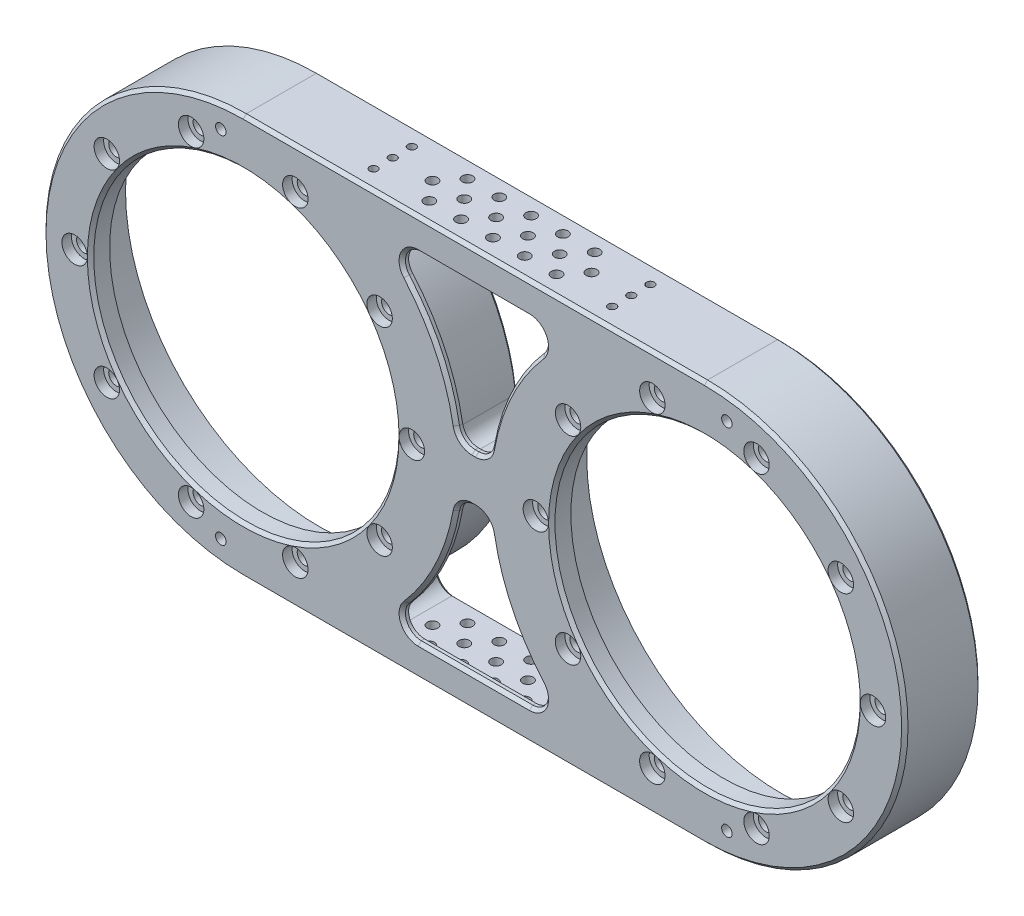
from build123d import *

# Parameters (mm, degrees)
SKETCH_1_R                   = 60
EXTRUDE_1_DEPTH              = 3
EXTRUDE_START                = 6
SKETCH_2_R                   = 48
EXTRUDE_2_DEPTH              = 6
SKETCH_3_R                   = 61
EXTRUDE_3_DEPTH              = 15
CUT_EXTRUDE_START            = -22
CUT_EXTRUDE_1_DEPTH          = 22
CUT_EXTRUDE_2_DEPTH          = 20
FILLET_2_R                   = 5
CHAMFER_2_SIZE               = 1
PATTERN_CIRCULAR_1_COUNT     = 10
PATTERN_CIRCULAR_2_COUNT     = 10
HOLE_WIZARD_M4_1_AT_2_COUNT  = 2
HOLE_WIZARD_M4_1_AT_2_PITCH  = 12
HOLE_WIZARD_M4_1_AT_3_COUNT  = 2
HOLE_WIZARD_M4_1_AT_3_PITCH  = 7.810249676
HOLE_WIZARD_M4_1_AT_4_COUNT  = 2
HOLE_WIZARD_M4_1_AT_4_PITCH  = 7.810249676
HOLE_WIZARD_M4_1_AT_5_COUNT  = 2
HOLE_WIZARD_M4_1_AT_5_PITCH  = 10
HOLE_WIZARD_M4_1_AT_6_COUNT  = 2
HOLE_WIZARD_M4_1_AT_6_PITCH  = 16.155494421
HOLE_WIZARD_M4_1_AT_7_COUNT  = 2
HOLE_WIZARD_M4_1_AT_7_PITCH  = 15.620499352
HOLE_WIZARD_M4_1_AT_8_COUNT  = 2
HOLE_WIZARD_M4_1_AT_8_PITCH  = 23.323807579
HOLE_WIZARD_M4_1_AT_9_COUNT  = 2
HOLE_WIZARD_M4_1_AT_9_PITCH  = 25.709920264
HOLE_WIZARD_M4_1_AT_10_COUNT = 2
HOLE_WIZARD_M4_1_AT_10_PITCH = 20
HOLE_WIZARD_M4_1_AT_11_COUNT = 2
HOLE_WIZARD_M4_1_AT_11_PITCH = 10
HOLE_WIZARD_M4_1_AT_12_COUNT = 2
HOLE_WIZARD_M4_1_AT_12_PITCH = 16.155494421
HOLE_WIZARD_M4_1_AT_13_COUNT = 2
HOLE_WIZARD_M4_1_AT_13_PITCH = 15.620499352
HOLE_WIZARD_M4_1_AT_14_COUNT = 2
HOLE_WIZARD_M4_1_AT_14_PITCH = 23.323807579
HOLE_WIZARD_M4_1_AT_15_COUNT = 2
HOLE_WIZARD_M4_1_AT_15_PITCH = 25.709920264
HOLE_WIZARD_M4_1_AT_16_COUNT = 2
HOLE_WIZARD_M4_1_AT_16_PITCH = 20
HOLE_WIZARD_M3_1_AT_2_COUNT  = 2
HOLE_WIZARD_M3_1_AT_2_PITCH  = 6
HOLE_WIZARD_M3_1_AT_3_COUNT  = 2
HOLE_WIZARD_M3_1_AT_3_PITCH  = 12
HOLE_WIZARD_M3_1_AT_4_COUNT  = 2
HOLE_WIZARD_M3_1_AT_4_PITCH  = 75.953933407
HOLE_WIZARD_M3_1_AT_5_COUNT  = 2
HOLE_WIZARD_M3_1_AT_5_PITCH  = 75.239617224
HOLE_WIZARD_M3_1_AT_6_COUNT  = 2
HOLE_WIZARD_M3_1_AT_6_PITCH  = 75
HOLE_WIZARD_M4_2_D           = 3.3
HOLE_WIZARD_M4_2_DEPTH       = 22
HOLE_WIZARD_M4_2_TIP         = 0.991420021


with BuildPart() as part:
    # 草图1 → 凸台-拉伸1 (new body)
    with BuildSketch(Plane.XY):
        with BuildLine():
            Line((0, 63), (145, 63))
            ThreePointArc((145, 63), (208, 0), (145, -63))
            Line((145, -63), (0, -63))
            ThreePointArc((0, -63), (-63, 0), (0, 63))
        make_face()
        Circle(SKETCH_1_R, mode=Mode.SUBTRACT)
        with Locations((145, 0)):
            Circle(SKETCH_1_R, mode=Mode.SUBTRACT)
    extrude(amount=-EXTRUDE_1_DEPTH)

    # 草图2 → 凸台-拉伸2 (add)
    with BuildSketch(Plane.XY.offset(EXTRUDE_START)):
        with BuildLine():
            Line((0, -63), (145, -63))
            ThreePointArc((145, -63), (208, 0), (145, 63))
            Line((145, 63), (0, 63))
            ThreePointArc((0, 63), (-63, 0), (0, -63))
        make_face()
        Circle(SKETCH_2_R, mode=Mode.SUBTRACT)
        with Locations((145, 0)):
            Circle(SKETCH_2_R, mode=Mode.SUBTRACT)
    extrude(amount=-EXTRUDE_2_DEPTH)

    # 草图3 → 凸台-拉伸3 (add)
    with BuildSketch(Plane(origin=(0, 0, -3), x_dir=(-1, 0, 0), z_dir=(0, 0, -1))):
        with BuildLine():
            Line((0, 63), (-145, 63))
            ThreePointArc((-145, 63), (-208, 0), (-145, -63))
            Line((-145, -63), (0, -63))
            ThreePointArc((0, -63), (63, 0), (0, 63))
        make_face()
        with Locations((-145, 0)):
            Circle(SKETCH_3_R, mode=Mode.SUBTRACT)
        Circle(SKETCH_3_R, mode=Mode.SUBTRACT)
    extrude(amount=EXTRUDE_3_DEPTH)

    # 草图4 → 切除-拉伸1 (cut)
    with BuildSketch(Plane(origin=(0, 0, -18), x_dir=(-1, 0, 0), z_dir=(0, 0, -1)).offset(CUT_EXTRUDE_START)):
        with BuildLine():
            ThreePointArc((-120.403252248, 58), (-93.171559203, 35.816375089), (-82.049622718, 2.5))
            Line((-82.049622718, 2.5), (-62.950377282, 2.5))
            ThreePointArc((-62.950377282, 2.5), (-51.828440797, 35.816375089), (-24.596747752, 58))
            Line((-24.596747752, 58), (-120.403252248, 58))
        make_face()
        with BuildLine():
            Line((-62.950377282, -2.5), (-82.049622718, -2.5))
            ThreePointArc((-82.049622718, -2.5), (-93.171559203, -35.816375089), (-120.403252248, -58))
            Line((-120.403252248, -58), (-24.596747752, -58))
            ThreePointArc((-24.596747752, -58), (-51.828440797, -35.816375089), (-62.950377282, -2.5))
        make_face()
    extrude(amount=CUT_EXTRUDE_1_DEPTH, mode=Mode.SUBTRACT)

    # 草图7 → 切除-拉伸2 (cut)
    with BuildSketch(Plane(origin=(0, 0, 4), x_dir=(-1, 0, 0), z_dir=(0, 0, -1))):
        with BuildLine():
            Line((-42.602816808, 53), (-102.397183192, 53))
            ThreePointArc((-102.397183192, 53), (-85.393721068, 32.72753446), (-77.414868499, 7.5))
            Line((-77.414868499, 7.5), (-67.585131501, 7.5))
            ThreePointArc((-67.585131501, 7.5), (-59.606278932, 32.72753446), (-42.602816808, 53))
        make_face()
        with BuildLine():
            Line((-67.585131501, -7.5), (-77.414868499, -7.5))
            ThreePointArc((-77.414868499, -7.5), (-85.393721068, -32.72753446), (-102.397183192, -53))
            Line((-102.397183192, -53), (-42.602816808, -53))
            ThreePointArc((-42.602816808, -53), (-59.606278932, -32.72753446), (-67.585131501, -7.5))
        make_face()
    extrude(amount=-CUT_EXTRUDE_2_DEPTH, mode=Mode.SUBTRACT)

    # 圆角2
    fillet_2_edges = [part.edges().sort_by_distance(p)[0] for p in [
        (42.602816808, 53, 5),
        (67.585131501, 7.5, 5),
        (77.414868499, 7.5, 5),
        (102.397183192, 53, 5),
        (24.596747752, 58, -7),
        (62.950377282, 2.5, -7),
        (82.049622718, 2.5, -7),
        (120.403252248, 58, -7),
        (62.950377282, -2.5, -7),
        (24.596747752, -58, -7),
        (120.403252248, -58, -7),
        (82.049622718, -2.5, -7),
        (67.585131501, -7.5, 5),
        (42.602816808, -53, 5),
        (102.397183192, -53, 5),
        (77.414868499, -7.5, 5),
    ]]
    fillet(fillet_2_edges, radius=FILLET_2_R)

    # 倒角2
    chamfer_2_edges = [part.edges().sort_by_distance(p)[0] for p in [
        (-60, 0, -3),
        (61.383052994, 29.259542121, 6),
        (72.5, 7.5, 6),
        (83.616947006, 29.259542121, 6),
        (61.383052994, -29.259542121, 6),
        (72.5, -53, 6),
        (83.616947006, -29.259542121, 6),
        (72.5, -7.5, 6),
        (72.5, 53, 6),
        (72.5, 2.5, -18),
        (89.776535695, 30.321098103, -18),
        (55.223464305, 30.321098103, -18),
        (72.5, 58, -18),
        (89.776535695, -30.321098103, -18),
        (72.5, -2.5, -18),
        (85, 0, -3),
        (72.5, -58, -18),
        (55.223464305, -30.321098103, -18),
        (68.703201021, 8.673721004, 6),
        (76.296798979, 8.673721004, 6),
        (50.448167613, -50.069014722, 6),
        (94.551832387, -50.069014722, 6),
        (76.296798979, -8.673721004, 6),
        (68.703201021, -8.673721004, 6),
        (50.448167613, 50.069014722, 6),
        (94.551832387, 50.069014722, 6),
        (80.749733343, 3.774590429, -18),
        (64.250266657, 3.774590429, -18),
        (37.886605717, 54.66052791, -18),
        (80.749733343, -3.774590429, -18),
        (107.113394283, -54.66052791, -18),
        (37.886605717, -54.66052791, -18),
        (64.250266657, -3.774590429, -18),
        (107.113394283, 54.66052791, -18),
        (-63, 0, 6),
        (72.5, -63, 6),
        (208, 0, 6),
        (72.5, 63, 6),
        (-48, 0, 6),
        (97, 0, 6),
        (-63, 0, -18),
        (72.5, 63, -18),
        (208, 0, -18),
        (72.5, -63, -18),
    ]]
    chamfer(chamfer_2_edges, length=CHAMFER_2_SIZE - 0.0001)  # a hair under: the kernel refuses the full size

    # 草图10 → 打孔尺寸(%根据)内六角圆柱头螺钉的类型1 (revolve, cut)
    with BuildSketch(Plane(origin=(198, 0, 6), x_dir=(0, -1, 0), z_dir=(1, 0, 0))):
        Polygon((0, 0), (0, 11.542065486), (2.4, 10.1), (2.4, 3), (4, 3), (4, 0), align=None)
    hole_wizard_1 = revolve(axis=Axis((198, 0, 12.35), (0, 0, -1)), mode=Mode.SUBTRACT)

    # 草图12 → 打孔尺寸(%根据)内六角圆柱头螺钉的类型2 (revolve, cut)
    with BuildSketch(Plane(origin=(53, 0, 6), x_dir=(0, -1, 0), z_dir=(1, 0, 0))):
        Polygon((0, 0), (0, 11.542065486), (2.4, 10.1), (2.4, 3), (4, 3), (4, 0), align=None)
    hole_wizard_2 = revolve(axis=Axis((53, 0, 12.35), (0, 0, -1)), mode=Mode.SUBTRACT)

    # 阵列(圆周)1: 打孔尺寸(%根据)内六角圆柱头螺钉的类型1 ×10 about axis
    pattern_circular_1_axis = Axis((145, 0, 0), (0, 0, 1))
    for i in range(1, PATTERN_CIRCULAR_1_COUNT):
        add(hole_wizard_1.rotate(pattern_circular_1_axis, i * 360 / PATTERN_CIRCULAR_1_COUNT), mode=Mode.SUBTRACT)

    # 阵列(圆周)2: 打孔尺寸(%根据)内六角圆柱头螺钉的类型2 ×10 about axis
    pattern_circular_2_axis = Axis((0, 0, 0), (0, 0, 1))
    for i in range(1, PATTERN_CIRCULAR_2_COUNT):
        add(hole_wizard_2.rotate(pattern_circular_2_axis, i * 360 / PATTERN_CIRCULAR_2_COUNT), mode=Mode.SUBTRACT)

    # 草图18 → M4 螺纹孔1 (revolve, cut)
    with BuildSketch(Plane(origin=(72.5, 63, -12), x_dir=(0, 0, 1), z_dir=(1, 0, 0))):
        Polygon((0, 0), (0, 11.091420021), (1.65, 10.1), (1.65, 0), align=None)
    hole_wizard_m4_1 = revolve(axis=Axis((72.5, 69.35, -12), (0, -1, 0)), mode=Mode.SUBTRACT)

    # M4 螺纹孔1 at 2: M4 螺纹孔1 ×2
    with Locations(*[(0, 0, i * HOLE_WIZARD_M4_1_AT_2_PITCH) for i in range(1, HOLE_WIZARD_M4_1_AT_2_COUNT)]):
        add(hole_wizard_m4_1, mode=Mode.SUBTRACT)

    # M4 螺纹孔1 at 3: M4 螺纹孔1 ×2
    with Locations(*[Vector(0.6401843996644799, 0, 0.7682212795973757) * (i * HOLE_WIZARD_M4_1_AT_3_PITCH) for i in range(1, HOLE_WIZARD_M4_1_AT_3_COUNT)]):
        add(hole_wizard_m4_1, mode=Mode.SUBTRACT)

    # M4 螺纹孔1 at 4: M4 螺纹孔1 ×2
    with Locations(*[Vector(-0.6401843996644809, 0, 0.768221279597375) * (i * HOLE_WIZARD_M4_1_AT_4_PITCH) for i in range(1, HOLE_WIZARD_M4_1_AT_4_COUNT)]):
        add(hole_wizard_m4_1, mode=Mode.SUBTRACT)

    # M4 螺纹孔1 at 5: M4 螺纹孔1 ×2
    with Locations(*[(-i * HOLE_WIZARD_M4_1_AT_5_PITCH, 0, 0) for i in range(1, HOLE_WIZARD_M4_1_AT_5_COUNT)]):
        add(hole_wizard_m4_1, mode=Mode.SUBTRACT)

    # M4 螺纹孔1 at 6: M4 螺纹孔1 ×2
    with Locations(*[Vector(-0.9284766908852594, 0, 0.3713906763541038) * (i * HOLE_WIZARD_M4_1_AT_6_PITCH) for i in range(1, HOLE_WIZARD_M4_1_AT_6_COUNT)]):
        add(hole_wizard_m4_1, mode=Mode.SUBTRACT)

    # M4 螺纹孔1 at 7: M4 螺纹孔1 ×2
    with Locations(*[Vector(-0.6401843996644804, 0, 0.7682212795973755) * (i * HOLE_WIZARD_M4_1_AT_7_PITCH) for i in range(1, HOLE_WIZARD_M4_1_AT_7_COUNT)]):
        add(hole_wizard_m4_1, mode=Mode.SUBTRACT)

    # M4 螺纹孔1 at 8: M4 螺纹孔1 ×2
    with Locations(*[Vector(-0.8574929257125442, 0, 0.5144957554275265) * (i * HOLE_WIZARD_M4_1_AT_8_PITCH) for i in range(1, HOLE_WIZARD_M4_1_AT_8_COUNT)]):
        add(hole_wizard_m4_1, mode=Mode.SUBTRACT)

    # M4 螺纹孔1 at 9: M4 螺纹孔1 ×2
    with Locations(*[Vector(-0.9723873019805175, 0, 0.23337295247532414) * (i * HOLE_WIZARD_M4_1_AT_9_PITCH) for i in range(1, HOLE_WIZARD_M4_1_AT_9_COUNT)]):
        add(hole_wizard_m4_1, mode=Mode.SUBTRACT)

    # M4 螺纹孔1 at 10: M4 螺纹孔1 ×2
    with Locations(*[(-i * HOLE_WIZARD_M4_1_AT_10_PITCH, 0, 0) for i in range(1, HOLE_WIZARD_M4_1_AT_10_COUNT)]):
        add(hole_wizard_m4_1, mode=Mode.SUBTRACT)

    # M4 螺纹孔1 at 11: M4 螺纹孔1 ×2
    with Locations(*[(i * HOLE_WIZARD_M4_1_AT_11_PITCH, 0, 0) for i in range(1, HOLE_WIZARD_M4_1_AT_11_COUNT)]):
        add(hole_wizard_m4_1, mode=Mode.SUBTRACT)

    # M4 螺纹孔1 at 12: M4 螺纹孔1 ×2
    with Locations(*[Vector(0.9284766908852594, 0, 0.37139067635410344) * (i * HOLE_WIZARD_M4_1_AT_12_PITCH) for i in range(1, HOLE_WIZARD_M4_1_AT_12_COUNT)]):
        add(hole_wizard_m4_1, mode=Mode.SUBTRACT)

    # M4 螺纹孔1 at 13: M4 螺纹孔1 ×2
    with Locations(*[Vector(0.6401843996644798, 0, 0.768221279597376) * (i * HOLE_WIZARD_M4_1_AT_13_PITCH) for i in range(1, HOLE_WIZARD_M4_1_AT_13_COUNT)]):
        add(hole_wizard_m4_1, mode=Mode.SUBTRACT)

    # M4 螺纹孔1 at 14: M4 螺纹孔1 ×2
    with Locations(*[Vector(0.8574929257125442, 0, 0.5144957554275267) * (i * HOLE_WIZARD_M4_1_AT_14_PITCH) for i in range(1, HOLE_WIZARD_M4_1_AT_14_COUNT)]):
        add(hole_wizard_m4_1, mode=Mode.SUBTRACT)

    # M4 螺纹孔1 at 15: M4 螺纹孔1 ×2
    with Locations(*[Vector(0.9723873019805176, 0, 0.23337295247532397) * (i * HOLE_WIZARD_M4_1_AT_15_PITCH) for i in range(1, HOLE_WIZARD_M4_1_AT_15_COUNT)]):
        add(hole_wizard_m4_1, mode=Mode.SUBTRACT)

    # M4 螺纹孔1 at 16: M4 螺纹孔1 ×2
    with Locations(*[(i * HOLE_WIZARD_M4_1_AT_16_PITCH, 0, 0) for i in range(1, HOLE_WIZARD_M4_1_AT_16_COUNT)]):
        add(hole_wizard_m4_1, mode=Mode.SUBTRACT)

    # 镜向1: M4 螺纹孔1 across plane
    add(hole_wizard_m4_1.mirror(Plane.ZX), mode=Mode.SUBTRACT)

    # 镜向1 copy 1 sketch → 镜向1 copy 1 (revolve, cut)
    with BuildSketch(Plane(origin=(72.5, -63, 0), x_dir=(0, 0, 1), z_dir=(1, 0, 0))):
        Polygon((0, 0), (0, -11.091420021), (1.65, -10.1), (1.65, 0), align=None)
    revolve(axis=Axis((72.5, -69.35, 0), (0, -1, 0)), mode=Mode.SUBTRACT)

    # 镜向1 copy 2 sketch → 镜向1 copy 2 (revolve, cut)
    with BuildSketch(Plane(origin=(77.5, -63, -6), x_dir=(0, 0, 1), z_dir=(1, 0, 0))):
        Polygon((0, 0), (0, -11.091420021), (1.65, -10.1), (1.65, 0), align=None)
    revolve(axis=Axis((77.5, -69.35, -6), (0, -1, 0)), mode=Mode.SUBTRACT)

    # 镜向1 copy 3 sketch → 镜向1 copy 3 (revolve, cut)
    with BuildSketch(Plane(origin=(67.5, -63, -6), x_dir=(0, 0, 1), z_dir=(1, 0, 0))):
        Polygon((0, 0), (0, -11.091420021), (1.65, -10.1), (1.65, 0), align=None)
    revolve(axis=Axis((67.5, -69.35, -6), (0, -1, 0)), mode=Mode.SUBTRACT)

    # 镜向1 copy 4 sketch → 镜向1 copy 4 (revolve, cut)
    with BuildSketch(Plane(origin=(62.5, -63, -12), x_dir=(0, 0, 1), z_dir=(1, 0, 0))):
        Polygon((0, 0), (0, -11.091420021), (1.65, -10.1), (1.65, 0), align=None)
    revolve(axis=Axis((62.5, -69.35, -12), (0, -1, 0)), mode=Mode.SUBTRACT)

    # 镜向1 copy 5 sketch → 镜向1 copy 5 (revolve, cut)
    with BuildSketch(Plane(origin=(57.5, -63, -6), x_dir=(0, 0, 1), z_dir=(1, 0, 0))):
        Polygon((0, 0), (0, -11.091420021), (1.65, -10.1), (1.65, 0), align=None)
    revolve(axis=Axis((57.5, -69.35, -6), (0, -1, 0)), mode=Mode.SUBTRACT)

    # 镜向1 copy 6 sketch → 镜向1 copy 6 (revolve, cut)
    with BuildSketch(Plane(origin=(62.5, -63, 0), x_dir=(0, 0, 1), z_dir=(1, 0, 0))):
        Polygon((0, 0), (0, -11.091420021), (1.65, -10.1), (1.65, 0), align=None)
    revolve(axis=Axis((62.5, -69.35, 0), (0, -1, 0)), mode=Mode.SUBTRACT)

    # 镜向1 copy 7 sketch → 镜向1 copy 7 (revolve, cut)
    with BuildSketch(Plane(origin=(52.5, -63, 0), x_dir=(0, 0, 1), z_dir=(1, 0, 0))):
        Polygon((0, 0), (0, -11.091420021), (1.65, -10.1), (1.65, 0), align=None)
    revolve(axis=Axis((52.5, -69.35, 0), (0, -1, 0)), mode=Mode.SUBTRACT)

    # 镜向1 copy 8 sketch → 镜向1 copy 8 (revolve, cut)
    with BuildSketch(Plane(origin=(47.5, -63, -6), x_dir=(0, 0, 1), z_dir=(1, 0, 0))):
        Polygon((0, 0), (0, -11.091420021), (1.65, -10.1), (1.65, 0), align=None)
    revolve(axis=Axis((47.5, -69.35, -6), (0, -1, 0)), mode=Mode.SUBTRACT)

    # 镜向1 copy 9 sketch → 镜向1 copy 9 (revolve, cut)
    with BuildSketch(Plane(origin=(52.5, -63, -12), x_dir=(0, 0, 1), z_dir=(1, 0, 0))):
        Polygon((0, 0), (0, -11.091420021), (1.65, -10.1), (1.65, 0), align=None)
    revolve(axis=Axis((52.5, -69.35, -12), (0, -1, 0)), mode=Mode.SUBTRACT)

    # 镜向1 copy 10 sketch → 镜向1 copy 10 (revolve, cut)
    with BuildSketch(Plane(origin=(82.5, -63, -12), x_dir=(0, 0, 1), z_dir=(1, 0, 0))):
        Polygon((0, 0), (0, -11.091420021), (1.65, -10.1), (1.65, 0), align=None)
    revolve(axis=Axis((82.5, -69.35, -12), (0, -1, 0)), mode=Mode.SUBTRACT)

    # 镜向1 copy 11 sketch → 镜向1 copy 11 (revolve, cut)
    with BuildSketch(Plane(origin=(87.5, -63, -6), x_dir=(0, 0, 1), z_dir=(1, 0, 0))):
        Polygon((0, 0), (0, -11.091420021), (1.65, -10.1), (1.65, 0), align=None)
    revolve(axis=Axis((87.5, -69.35, -6), (0, -1, 0)), mode=Mode.SUBTRACT)

    # 镜向1 copy 12 sketch → 镜向1 copy 12 (revolve, cut)
    with BuildSketch(Plane(origin=(82.5, -63, 0), x_dir=(0, 0, 1), z_dir=(1, 0, 0))):
        Polygon((0, 0), (0, -11.091420021), (1.65, -10.1), (1.65, 0), align=None)
    revolve(axis=Axis((82.5, -69.35, 0), (0, -1, 0)), mode=Mode.SUBTRACT)

    # 镜向1 copy 13 sketch → 镜向1 copy 13 (revolve, cut)
    with BuildSketch(Plane(origin=(92.5, -63, 0), x_dir=(0, 0, 1), z_dir=(1, 0, 0))):
        Polygon((0, 0), (0, -11.091420021), (1.65, -10.1), (1.65, 0), align=None)
    revolve(axis=Axis((92.5, -69.35, 0), (0, -1, 0)), mode=Mode.SUBTRACT)

    # 镜向1 copy 14 sketch → 镜向1 copy 14 (revolve, cut)
    with BuildSketch(Plane(origin=(97.5, -63, -6), x_dir=(0, 0, 1), z_dir=(1, 0, 0))):
        Polygon((0, 0), (0, -11.091420021), (1.65, -10.1), (1.65, 0), align=None)
    revolve(axis=Axis((97.5, -69.35, -6), (0, -1, 0)), mode=Mode.SUBTRACT)

    # 镜向1 copy 15 sketch → 镜向1 copy 15 (revolve, cut)
    with BuildSketch(Plane(origin=(92.5, -63, -12), x_dir=(0, 0, 1), z_dir=(1, 0, 0))):
        Polygon((0, 0), (0, -11.091420021), (1.65, -10.1), (1.65, 0), align=None)
    revolve(axis=Axis((92.5, -69.35, -12), (0, -1, 0)), mode=Mode.SUBTRACT)

    # 草图21 → M3 螺纹孔1 (revolve, cut)
    with BuildSketch(Plane(origin=(35, -63, 0), x_dir=(0, 0, -1), z_dir=(1, 0, 0))):
        Polygon((0, 0), (0, 8.251075774), (1.25, 7.5), (1.25, 0), align=None)
    hole_wizard_m3_1 = revolve(axis=Axis((35, -69.35, 0), (0, 1, 0)), mode=Mode.SUBTRACT)

    # M3 螺纹孔1 at 2: M3 螺纹孔1 ×2
    with Locations(*[(0, 0, -i * HOLE_WIZARD_M3_1_AT_2_PITCH) for i in range(1, HOLE_WIZARD_M3_1_AT_2_COUNT)]):
        add(hole_wizard_m3_1, mode=Mode.SUBTRACT)

    # M3 螺纹孔1 at 3: M3 螺纹孔1 ×2
    with Locations(*[(0, 0, -i * HOLE_WIZARD_M3_1_AT_3_PITCH) for i in range(1, HOLE_WIZARD_M3_1_AT_3_COUNT)]):
        add(hole_wizard_m3_1, mode=Mode.SUBTRACT)

    # M3 螺纹孔1 at 4: M3 螺纹孔1 ×2
    with Locations(*[Vector(0.9874406319167054, 0, -0.15799050110667287) * (i * HOLE_WIZARD_M3_1_AT_4_PITCH) for i in range(1, HOLE_WIZARD_M3_1_AT_4_COUNT)]):
        add(hole_wizard_m3_1, mode=Mode.SUBTRACT)

    # M3 螺纹孔1 at 5: M3 螺纹孔1 ×2
    with Locations(*[Vector(0.9968152785361251, 0, -0.07974522228288984) * (i * HOLE_WIZARD_M3_1_AT_5_PITCH) for i in range(1, HOLE_WIZARD_M3_1_AT_5_COUNT)]):
        add(hole_wizard_m3_1, mode=Mode.SUBTRACT)

    # M3 螺纹孔1 at 6: M3 螺纹孔1 ×2
    with Locations(*[(i * HOLE_WIZARD_M3_1_AT_6_PITCH, 0, 0) for i in range(1, HOLE_WIZARD_M3_1_AT_6_COUNT)]):
        add(hole_wizard_m3_1, mode=Mode.SUBTRACT)

    # 镜向2: M3 螺纹孔1 across plane
    add(hole_wizard_m3_1.mirror(Plane.ZX), mode=Mode.SUBTRACT)

    # 镜向2 copy 1 sketch → 镜向2 copy 1 (revolve, cut)
    with BuildSketch(Plane(origin=(35, 63, -6), x_dir=(0, 0, -1), z_dir=(1, 0, 0))):
        Polygon((0, 0), (0, -8.251075774), (1.25, -7.5), (1.25, 0), align=None)
    revolve(axis=Axis((35, 69.35, -6), (0, 1, 0)), mode=Mode.SUBTRACT)

    # 镜向2 copy 2 sketch → 镜向2 copy 2 (revolve, cut)
    with BuildSketch(Plane(origin=(35, 63, -12), x_dir=(0, 0, -1), z_dir=(1, 0, 0))):
        Polygon((0, 0), (0, -8.251075774), (1.25, -7.5), (1.25, 0), align=None)
    revolve(axis=Axis((35, 69.35, -12), (0, 1, 0)), mode=Mode.SUBTRACT)

    # 镜向2 copy 3 sketch → 镜向2 copy 3 (revolve, cut)
    with BuildSketch(Plane(origin=(110, 63, -12), x_dir=(0, 0, -1), z_dir=(1, 0, 0))):
        Polygon((0, 0), (0, -8.251075774), (1.25, -7.5), (1.25, 0), align=None)
    revolve(axis=Axis((110, 69.35, -12), (0, 1, 0)), mode=Mode.SUBTRACT)

    # 镜向2 copy 4 sketch → 镜向2 copy 4 (revolve, cut)
    with BuildSketch(Plane(origin=(110, 63, -6), x_dir=(0, 0, -1), z_dir=(1, 0, 0))):
        Polygon((0, 0), (0, -8.251075774), (1.25, -7.5), (1.25, 0), align=None)
    revolve(axis=Axis((110, 69.35, -6), (0, 1, 0)), mode=Mode.SUBTRACT)

    # 镜向2 copy 5 sketch → 镜向2 copy 5 (revolve, cut)
    with BuildSketch(Plane(origin=(110, 63, 0), x_dir=(0, 0, -1), z_dir=(1, 0, 0))):
        Polygon((0, 0), (0, -8.251075774), (1.25, -7.5), (1.25, 0), align=None)
    revolve(axis=Axis((110, 69.35, 0), (0, 1, 0)), mode=Mode.SUBTRACT)

    # M4 螺纹孔2
    with Locations(Plane.XY.offset(6)):
        with Locations((-7.051818529, 55.752018275), (-7.051818529, -55.752018275), (152.051818529, -55.752018275), (152.051818529, 55.752018275)):
            Hole(HOLE_WIZARD_M4_2_D / 2, depth=HOLE_WIZARD_M4_2_DEPTH)
            with Locations((0, 0, -(HOLE_WIZARD_M4_2_DEPTH + HOLE_WIZARD_M4_2_TIP / 2))):  # 118° drill point
                Cone(0, HOLE_WIZARD_M4_2_D / 2, HOLE_WIZARD_M4_2_TIP, mode=Mode.SUBTRACT)


solid = part.part
